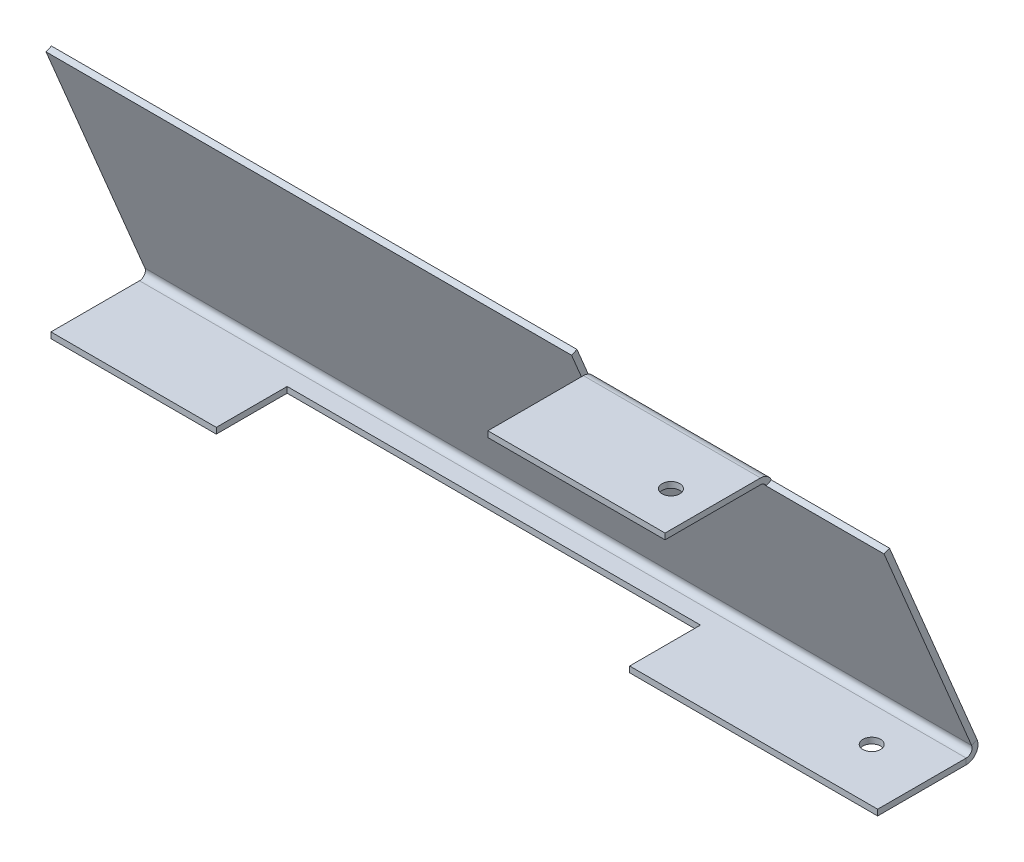
from build123d import *

# Parameters (mm, degrees)
T_LE_DE_BASE_PLI_E1_DEPTH = 140
ESQUISSE6_W               = 70
ESQUISSE6_H               = 12
ENL_V_MAT_EXTRU_1_DEPTH   = 1
ESQUISSE7_W               = 90
ESQUISSE7_H               = 8.077316225
ESQUISSE7_W_2             = 20
ENL_V_MAT_EXTRU_2_DEPTH   = 148.230392024
ESQUISSE8_W               = 89
ESQUISSE8_H               = 5
PATTE1_DEPTH              = 1
ESQUISSE11_R              = 1.5
ENL_V_MAT_EXTRU_3_DEPTH   = 1
ESQUISSE12_R              = 1.5
ENL_V_MAT_EXTRU_4_DEPTH   = 1


# Sheet-metal steps are written as plain solids
with BuildPart() as part:
    # Esquisse1 → Tôle de base pliée1 (new body)
    with BuildSketch(Plane(origin=(0, 0, 0), x_dir=(0, 0, -1), z_dir=(1, 0, 0))):
        with BuildLine():
            Line((0, 0), (14.997077996, 0))
            ThreePointArc((14.997077996, 0), (16.661676799, 0.891347294), (16.842539964, 2.770889177))
            Line((16.842539964, 2.770889177), (2.01342604, 38.270889177))
            ThreePointArc((2.01342604, 38.270889177), (1.276616778, 39.164598804), (0.167964072, 39.5))
            Line((0.167964072, 39.5), (-16, 39.5))
            Line((-16, 39.5), (-16, 38.5))
            Line((-16, 38.5), (0.167964072, 38.5))
            ThreePointArc((0.167964072, 38.5), (0.722290425, 38.332299402), (1.090695056, 37.885444588))
            Line((1.090695056, 37.885444588), (15.91980898, 2.385444588))
            ThreePointArc((15.91980898, 2.385444588), (15.829377397, 1.445673647), (14.997077996, 1))
            Line((14.997077996, 1), (0, 1))
            Line((0, 1), (0, 0))
        make_face()
    extrude(amount=-T_LE_DE_BASE_PLI_E1_DEPTH)

    # Esquisse6 → Enlèv. mat.-Extru.1 (cut)
    with BuildSketch(Plane.XZ):
        with Locations((-77, -6)):
            Rectangle(ESQUISSE6_W, ESQUISSE6_H)
    extrude(amount=-ENL_V_MAT_EXTRU_1_DEPTH, mode=Mode.SUBTRACT)

    # Esquisse7 → Enlèv. mat.-Extru.2 (cut, through all)
    with BuildSketch(Plane(origin=(0, 6.401909959, -15.325784447), x_dir=(-1, 0, 0), z_dir=(0, 0.38544458835969, -0.9227309842550152))):
        with Locations((95, 38.57632918)):
            Rectangle(ESQUISSE7_W, ESQUISSE7_H)
        with Locations((10, 38.57632918)):
            Rectangle(ESQUISSE7_W_2, ESQUISSE7_H)
    extrude(amount=-ENL_V_MAT_EXTRU_2_DEPTH, mode=Mode.SUBTRACT)

    # Esquisse8 → Patte1 (add)
    with BuildSketch(Plane(origin=(0, 6.401909959, -15.325784447), x_dir=(-1, 0, 0), z_dir=(0, 0.38544458835969003, -0.9227309842550152))):
        with Locations((95.5, 37.037671067)):
            Rectangle(ESQUISSE8_W, ESQUISSE8_H)
    extrude(amount=-PATTE1_DEPTH)

    # Esquisse11 → Enlèv. mat.-Extru.3 (cut)
    with BuildSketch(Plane(origin=(0, 1, 0), x_dir=(1, 0, 0), z_dir=(0, 1, 0))):
        with Locations(Location((-10, 9, 0), (0, 0, 270))):
            Circle(ESQUISSE11_R)
    extrude(amount=-ENL_V_MAT_EXTRU_3_DEPTH, mode=Mode.SUBTRACT)

    # Esquisse12 → Enlèv. mat.-Extru.4 (cut)
    with BuildSketch(Plane(origin=(0, 39.5, 0), x_dir=(1, 0, 0), z_dir=(0, 1, 0))):
        with Locations(Location((-26, -9, 0), (0, 0, 270))):
            Circle(ESQUISSE12_R)
    extrude(amount=-ENL_V_MAT_EXTRU_4_DEPTH, mode=Mode.SUBTRACT)


solid = part.part
